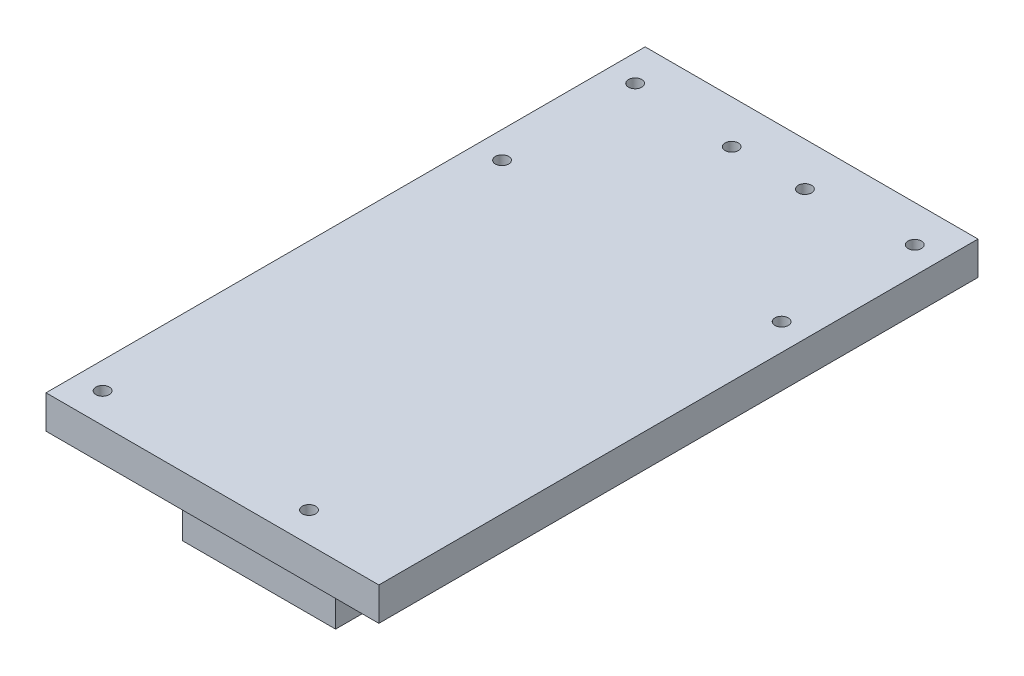
from build123d import *

# Parameters (mm, degrees)
SKETCH1_W           = 50
SKETCH1_H           = 90
BOSS_EXTRUDE1_DEPTH = 5
SKETCH2_R           = 1
CUT_EXTRUDE1_DEPTH  = 52.720402164
SKETCH3_W           = 23
SKETCH3_H           = 8
SKETCH3_R           = 1
BOSS_EXTRUDE2_DEPTH = 11


with BuildPart() as part:
    # Sketch1 → Boss-Extrude1 (new body)
    with BuildSketch(Plane(origin=(0, 0, 0), x_dir=(1, 0, 0), z_dir=(0, 1, 0))):
        Rectangle(SKETCH1_W, SKETCH1_H)
    extrude(amount=BOSS_EXTRUDE1_DEPTH)

    # Sketch2 → Cut-Extrude1 (cut, through all)
    with BuildSketch(Plane(origin=(0, 5, 0), x_dir=(1, 0, 0), z_dir=(0, 1, 0))):
        with Locations((21, 39.5)):
            Circle(SKETCH2_R)
        with Locations((21, 19.5)):
            Circle(SKETCH2_R)
        with Locations((-21, 19.5)):
            Circle(SKETCH2_R)
        with Locations((-21, 39.5)):
            Circle(SKETCH2_R)
        with Locations((10, -40.5)):
            Circle(SKETCH2_R)
        with Locations((-21, -40.5)):
            Circle(SKETCH2_R)
        with Locations((-5.5, 38.5)):
            Circle(SKETCH2_R)
        with Locations((5.5, 38.5)):
            Circle(SKETCH2_R)
    extrude(amount=-CUT_EXTRUDE1_DEPTH, mode=Mode.SUBTRACT)

    # Sketch3 → Boss-Extrude2 (add)
    with BuildSketch(Plane.XZ):
        with Locations((0, 34)):
            Rectangle(SKETCH3_W, SKETCH3_H)
        with Locations((7.5, 34)):
            Circle(SKETCH3_R, mode=Mode.SUBTRACT)
        with Locations((-7.5, 34)):
            Circle(SKETCH3_R, mode=Mode.SUBTRACT)
    extrude(amount=BOSS_EXTRUDE2_DEPTH)


solid = part.part
